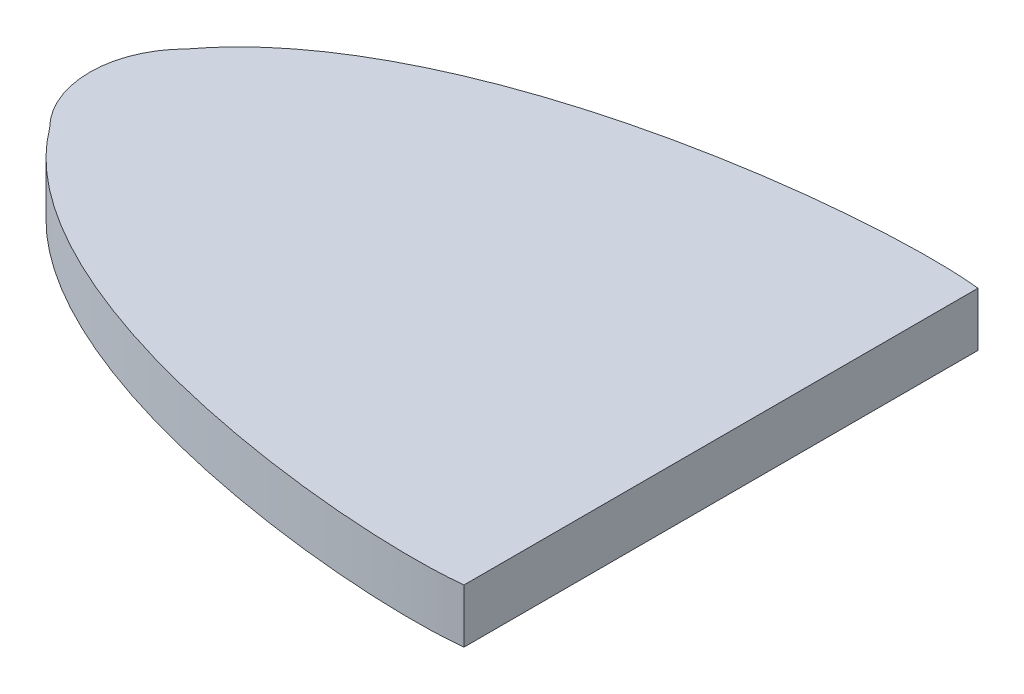
from build123d import *

# Parameters (mm, degrees)
BOSS_EXTRUDE1_DEPTH = 5


with BuildPart() as part:
    # Sketch1 → Boss-Extrude1 (new body)
    with BuildSketch(Plane(origin=(0, 0, 0), x_dir=(1, 0, 0), z_dir=(0, 1, 0))):
        with BuildLine():
            Line((2.681319983, -23.849748912), (2.681319983, 23.849748912))
            add(Edge.make_bspline(
                [(2.681319983, 23.849748912), (-7.808152901, 25.029558527), (-41.904509181, 21.605193261), (-53.263961031, 6.363961031)],
                knots=[0.995810024, 0.995810024, 0.995810024, 0.995810024, 1.995810024, 1.995810024, 1.995810024, 1.995810024], degree=3))
            ThreePointArc((-53.263961031, 6.363961031), (-55.9, 0), (-53.263961031, -6.363961031))
            add(Edge.make_bspline(
                [(-53.263961031, -6.363961031), (-41.904509181, -21.605193261), (-7.808152901, -25.029558527), (2.681319983, -23.849748912)],
                knots=[0, 0, 0, 0, 1, 1, 1, 1], degree=3))
        make_face()
    extrude(amount=BOSS_EXTRUDE1_DEPTH)


solid = part.part
